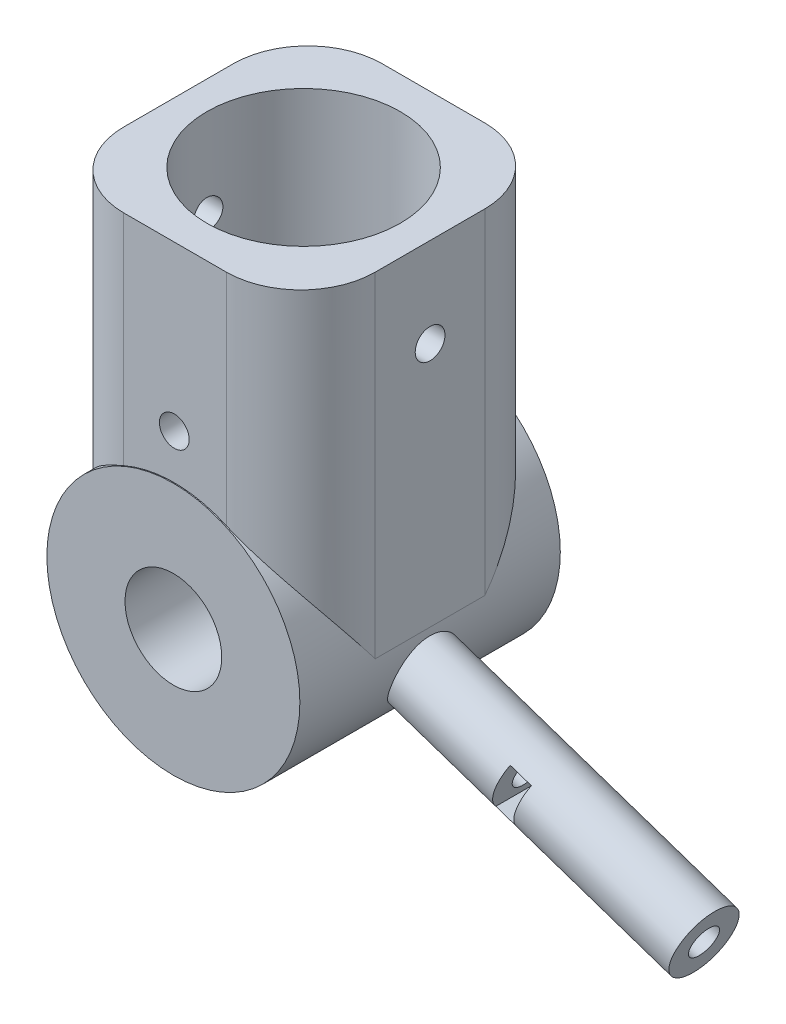
from build123d import *
from build123d.topology import SkipClean

# Parameters (mm, degrees)
SKETCH_1_R                        = 17
SKETCH_1_R_2                      = 6.5
EXTRUDE_2_DEPTH                   = 35
SKETCH_3_W                        = 33.795275063
SKETCH_3_H                        = 34.72803434
SKETCH_3_R                        = 13
EXTRUDE_7_DEPTH                   = 45
SKETCH_4_R                        = 6.5
CUT_EXTRUDE_1_DEPTH               = 60.489495005
SKETCH_12_R                       = 2
CUT_EXTRUDE_11_DEPTH              = 45
SKETCH_15_R                       = 2
CUT_EXTRUDE_12_DEPTH              = 45
FILLET_4_R                        = 10
SKETCH_20_R                       = 13
CUT_EXTRUDE_18_DEPTH              = 31
EXTRUDE_START                     = 1
SKETCH_25_R                       = 13
EXTRUDE_10_DEPTH                  = 1
SKETCH_26_R                       = 6.5
SKETCH_26_R_2                     = 5.5
EXTRUDE_11_DEPTH                  = 2
SKETCH_36_R                       = 4.5
SKETCH_36_R_2                     = 2
EXTRUDE_17_DEPTH                  = 15
EXTRUDE_17_DIRECTION_2_REACH      = 71.637
EXTRUDE_17_DIRECTION_2_END_RADIUS = 17
EXTRUDE_18_DEPTH                  = 3
SKETCH_38_R                       = 4.5
SKETCH_38_R_2                     = 2
EXTRUDE_20_DEPTH                  = 22


with BuildPart() as part:
    # Эскиз1 → Бобышка-Вытянуть2 (new body)
    with BuildSketch(Plane.XY):
        Circle(SKETCH_1_R)
        Circle(SKETCH_1_R_2, mode=Mode.SUBTRACT)
    extrude(amount=EXTRUDE_2_DEPTH)

    # Эскиз3 → Бобышка-Вытянуть7 (add)
    with BuildSketch(Plane(origin=(0, 45, 0), x_dir=(1, 0, 0), z_dir=(0, 1, 0))):
        with Locations((0.102362468, -17.511098906)):
            Rectangle(SKETCH_3_W, SKETCH_3_H)
        with Locations(Location((0, -17.5, 0), (0, 0, 270))):
            Circle(SKETCH_3_R, mode=Mode.SUBTRACT)
    extrude(amount=-EXTRUDE_7_DEPTH)

    # Эскиз4 → Вырез-Вытянуть1 (cut, through all)
    with BuildSketch(Plane(origin=(0, 0, 0), x_dir=(-1, 0, 0), z_dir=(0, 0, -1))):
        with Locations(Location((0, 0, 0), (0, 0, 180))):
            Circle(SKETCH_4_R)
    extrude(amount=-CUT_EXTRUDE_1_DEPTH, mode=Mode.SUBTRACT)

    # Эскиз12 → Вырез-Вытянуть11 (cut)
    with BuildSketch(Plane(origin=(0, 0, 0), x_dir=(-1, 0, 0), z_dir=(0, 0, -1))):
        with Locations((0, 23)):
            Circle(SKETCH_12_R)
    extrude(amount=-CUT_EXTRUDE_11_DEPTH, mode=Mode.SUBTRACT)

    # Эскиз15 → Вырез-Вытянуть12 (cut)
    with BuildSketch(Plane.ZY.offset(16.795275063)):
        with Locations((17.5, 33)):
            Circle(SKETCH_15_R)
    extrude(amount=-CUT_EXTRUDE_12_DEPTH, mode=Mode.SUBTRACT)

    # Скругление4
    # the kernel refuses this fillet: 10 mm, written as the material it takes off along each edge
    with BuildSketch(Plane(origin=(-16.795275063, 70, 34.875116076), x_dir=(1, 0, 0), z_dir=(0, -1, 0))) as fillet_4_piece_1_section:
        with BuildLine():
            CenterArc((FILLET_4_R, -FILLET_4_R), FILLET_4_R, 90, 90)
            Line((0, -FILLET_4_R), (0, 0))
            Line((0, 0), (FILLET_4_R, 0))
        make_face()
    fillet_4_piece_1 = extrude(amount=92.369651061, mode=Mode.PRIVATE)
    fillet_4_piece_1 = fillet_4_piece_1 - Plane(origin=(0, 0, 32.54483178), x_dir=(1, 0, 0), z_dir=(0, 0, -1)) * Cylinder(17, 225, mode=Mode.PRIVATE)
    add(fillet_4_piece_1, mode=Mode.SUBTRACT)
    with BuildSketch(Plane(origin=(17, 70, 0.147081736), x_dir=(0, 0, 1), z_dir=(0, -1, 0))) as fillet_4_piece_2_section:
        with BuildLine():
            CenterArc((FILLET_4_R, FILLET_4_R), FILLET_4_R, 180, 90)
            Line((0, FILLET_4_R), (0, 0))
            Line((0, 0), (FILLET_4_R, 0))
        make_face()
    fillet_4_piece_2 = extrude(amount=95, mode=Mode.PRIVATE)
    fillet_4_piece_2 = fillet_4_piece_2 - Plane(origin=(0, 0, 2.486350956), x_dir=(1, 0, 0), z_dir=(0, 0, -1)) * Cylinder(17, 230, mode=Mode.PRIVATE)
    add(fillet_4_piece_2, mode=Mode.SUBTRACT)
    with BuildSketch(Plane(origin=(17, 70, 34.875116076), x_dir=(0, 0, -1), z_dir=(0, -1, 0))) as fillet_4_piece_3_section:
        with BuildLine():
            CenterArc((FILLET_4_R, -FILLET_4_R), FILLET_4_R, 90, 90)
            Line((0, -FILLET_4_R), (0, 0))
            Line((0, 0), (FILLET_4_R, 0))
        make_face()
    fillet_4_piece_3 = extrude(amount=95, mode=Mode.PRIVATE)
    fillet_4_piece_3 = fillet_4_piece_3 - Plane(origin=(0, 0, 32.535846855), x_dir=(1, 0, 0), z_dir=(0, 0, -1)) * Cylinder(17, 230, mode=Mode.PRIVATE)
    add(fillet_4_piece_3, mode=Mode.SUBTRACT)
    with BuildSketch(Plane(origin=(-16.795275063, 70, 0.147081736), x_dir=(0, 0, 1), z_dir=(0, -1, 0))) as fillet_4_piece_4_section:
        with BuildLine():
            CenterArc((FILLET_4_R, -FILLET_4_R), FILLET_4_R, 90, 90)
            Line((0, -FILLET_4_R), (0, 0))
            Line((0, 0), (FILLET_4_R, 0))
        make_face()
    fillet_4_piece_4 = extrude(amount=92.369651061, mode=Mode.PRIVATE)
    fillet_4_piece_4 = fillet_4_piece_4 - Plane(origin=(0, 0, 2.477367304), x_dir=(1, 0, 0), z_dir=(0, 0, -1)) * Cylinder(17, 225, mode=Mode.PRIVATE)
    add(fillet_4_piece_4, mode=Mode.SUBTRACT)

    # Эскиз20 → Вырез-Вытянуть18 (cut)
    with SkipClean():  # the faces are left unmerged after this step: merging them gives an invalid solid
        with BuildSketch(Plane(origin=(0, 45, 0), x_dir=(1, 0, 0), z_dir=(0, 1, 0))):
            with Locations(Location((0, -17.5, 0), (0, 0, 270))):
                Circle(SKETCH_20_R)
        extrude(amount=-CUT_EXTRUDE_18_DEPTH, mode=Mode.SUBTRACT)

    # Эскиз25 → Бобышка-Вытянуть10 (add)
    with BuildSketch(Plane(origin=(0, 14, 0), x_dir=(1, 0, 0), z_dir=(0, 1, 0)).offset(EXTRUDE_START)):
        with Locations(Location((0, -17.5, 0), (0, 0, 270))):
            Circle(SKETCH_25_R)
    extrude(amount=-EXTRUDE_10_DEPTH)

    # Эскиз26 → Бобышка-Вытянуть11 (add)
    with BuildSketch(Plane(origin=(0, 0, 0), x_dir=(-1, 0, 0), z_dir=(0, 0, -1))):
        Circle(SKETCH_26_R)
        Circle(SKETCH_26_R_2, mode=Mode.SUBTRACT)
    extrude(amount=-EXTRUDE_11_DEPTH)

    # Эскиз36 → Бобышка-Вытянуть17 (add)
    with BuildSketch(Plane(origin=(15.965526333, -5.379751182, 0.007630631), x_dir=(0.001361712962568806, 0.0026227730541390965, -0.9999956333901235), z_dir=(0.9476469847760447, -0.31931956893709296, 0.00045292239977668937))):
        with Locations(Location((-17.511098906, 0, 0), (0, 0, 269.832679764))):
            Circle(SKETCH_36_R)
        with Locations(Location((-17.511098906, 0, 0), (0, 0, 269.832679764))):
            Circle(SKETCH_36_R_2, mode=Mode.SUBTRACT)
    extrude(amount=EXTRUDE_17_DEPTH)

    # Бобышка-Вытянуть17 direction 2: up to this cylinder (the profile starts outside it)
    with SkipClean():  # the faces are left unmerged after this step: merging them gives an invalid solid
        extrude_17_direction_2_end = Plane(origin=(0, 0, 17.518653), z_dir=(0, 0, -1)) * Cylinder(EXTRUDE_17_DIRECTION_2_END_RADIUS, 178.274, mode=Mode.PRIVATE)
        # Эскиз36 → Бобышка-Вытянуть17 direction 2 (add, up to the surface)
        with BuildSketch(Plane(origin=(15.965526333, -5.379751182, 0.007630631), x_dir=(0.001361712962568806, 0.0026227730541390965, -0.9999956333901235), z_dir=(0.9476469847760447, -0.31931956893709296, 0.00045292239977668937)), mode=Mode.PRIVATE) as extrude_17_direction_2_sk1:
            with Locations(Location((-17.511098906, 0, 0), (0, 0, 269.832679764))):
                Circle(SKETCH_36_R)
            with Locations(Location((-17.511098906, 0, 0), (0, 0, 269.832679764))):
                Circle(SKETCH_36_R_2, mode=Mode.SUBTRACT)
        extrude_17_direction_2_tool1 = extrude(extrude_17_direction_2_sk1.sketch, amount=-EXTRUDE_17_DIRECTION_2_REACH, mode=Mode.PRIVATE) - extrude_17_direction_2_end
        add(extrude_17_direction_2_tool1.solids().sort_by_distance((17.337977, -1.281883, 17.518653))[0])
        add(extrude_17_direction_2_tool1.solids().sort_by_distance((17.337977, -1.281883, 17.518653))[1])

    # Эскиз37 → Бобышка-Вытянуть18 (add)
    with SkipClean():  # the faces are left unmerged after this step: merging them gives an invalid solid
        with BuildSketch(Plane(origin=(30.180231104, -10.169544716, 0.014424467), x_dir=(0.00042921059050976356, -0.00014462700029294434, -0.9999998974306447), z_dir=(0.9476469847760448, -0.31931956893709273, 0.0004529223997766894))):
            with BuildLine():
                Line((-19.261024238, 2.979951516), (-20.837057911, 2.979951516))
                ThreePointArc((-20.837057911, 2.979951516), (-13.011024238, -0.051137397), (-20.837057911, -3.08222631))
                Line((-20.837057911, -3.08222631), (-19.261024238, -3.08222631))
                Line((-19.261024238, -3.08222631), (-15.761024238, -3.08222631))
                Line((-15.761024238, -3.08222631), (-14.011024238, -0.051137397))
                Line((-14.011024238, -0.051137397), (-15.761024238, 2.979951516))
                Line((-15.761024238, 2.979951516), (-19.261024238, 2.979951516))
            make_face()
        extrude(amount=EXTRUDE_18_DEPTH)

    # Эскиз38 → Бобышка-Вытянуть20 (add)
    with SkipClean():  # the faces are left unmerged after this step: merging them gives an invalid solid
        with BuildSketch(Plane(origin=(33.023172059, -11.127503423, 0.015783234), x_dir=(0.0004292105905097637, -0.00014462700029294434, -0.9999998974306447), z_dir=(0.9476469847760447, -0.3193195689370928, 0.00045292239977668953))):
            with Locations(Location((-17.511024238, -0.051137397, 0), (0, 0, 270))):
                Circle(SKETCH_38_R)
            with Locations(Location((-17.511024238, -0.051137397, 0), (0, 0, 270))):
                Circle(SKETCH_38_R_2, mode=Mode.SUBTRACT)
        extrude(amount=EXTRUDE_20_DEPTH)


solid = part.part
